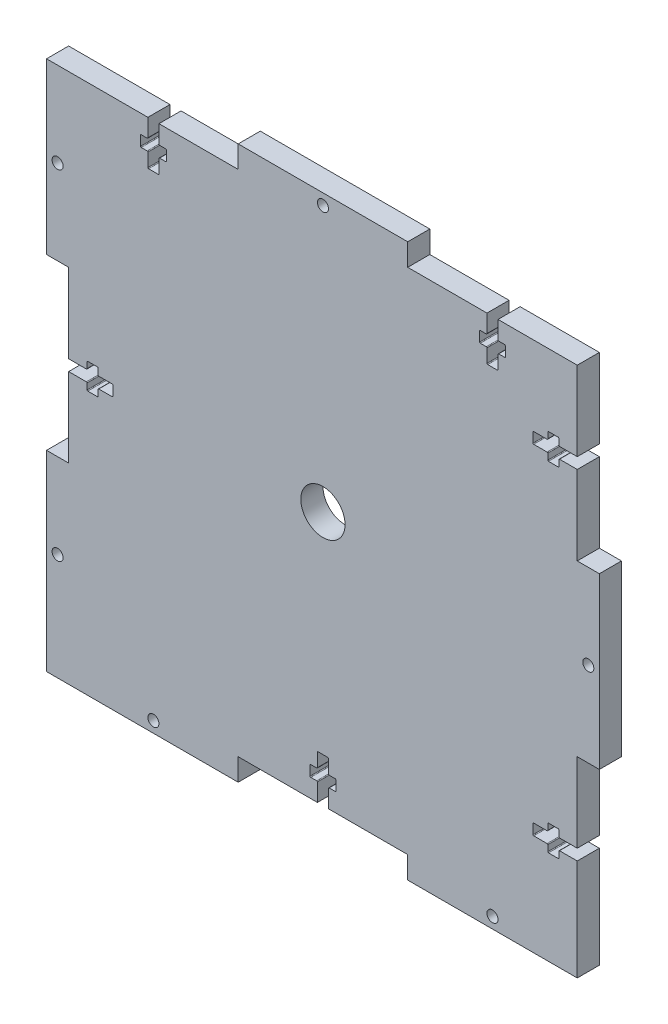
from build123d import *

# Parameters (mm, degrees)
BOX_SIDE_DEPTH       = 6
SKETCH2_R            = 1.5
SCREW_CUT_OUTS_DEPTH = 107.235587258
SKETCH3_R            = 6
BEARINGHOLE_DEPTH    = 107.235587258


with BuildPart() as part:
    # Sketch1 → Box Side (new body)
    with BuildSketch(Plane.XY):
        Polygon((-69, 69), (-23, 69), (-23, 75), (23, 75), (23, 69), (69, 69), (69, 23), (75, 23), (75, -23), (69, -23), (69, -69), (69, -75), (23, -75), (23, -69), (-23, -69), (-23, -75), (-69, -75), (-75, -75), (-75, -69), (-75, -23), (-69, -23), (-69, 23), (-75, 23), (-75, 69), align=None)
    extrude(amount=BOX_SIDE_DEPTH)

    # Sketch2 → Screw Cut-outs (cut, through all)
    with BuildSketch(Plane.XY.offset(6)):
        with Locations((0, 72)):
            Circle(SKETCH2_R)
        with Locations((72, 0)):
            Circle(SKETCH2_R)
        with Locations((-46, -72)):
            Circle(SKETCH2_R)
        with Locations((46, -72)):
            Circle(SKETCH2_R)
        with Locations((-72, 46)):
            Circle(SKETCH2_R)
        with Locations((-72, -46)):
            Circle(SKETCH2_R)
        with BuildLine():
            Line((-44.5, 69), (-44.5, 64.2))
            ThreePointArc((-44.5, 64.2), (-44.441421356, 64.058578644), (-44.3, 64))
            Line((-44.3, 64), (-42.7, 64))
            ThreePointArc((-42.7, 64), (-42.558578644, 63.941421356), (-42.5, 63.8))
            Line((-42.5, 63.8), (-42.5, 61.2))
            ThreePointArc((-42.5, 61.2), (-42.558578644, 61.058578644), (-42.7, 61))
            Line((-42.7, 61), (-44.3, 61))
            ThreePointArc((-44.3, 61), (-44.441421356, 60.941421356), (-44.5, 60.8))
            Line((-44.5, 60.8), (-44.5, 57.2))
            ThreePointArc((-44.5, 57.2), (-44.558578644, 57.058578644), (-44.7, 57))
            Line((-44.7, 57), (-47.3, 57))
            ThreePointArc((-47.3, 57), (-47.441421356, 57.058578644), (-47.5, 57.2))
            Line((-47.5, 57.2), (-47.5, 60.8))
            ThreePointArc((-47.5, 60.8), (-47.558578644, 60.941421356), (-47.7, 61))
            Line((-47.7, 61), (-49.3, 61))
            ThreePointArc((-49.3, 61), (-49.441421356, 61.058578644), (-49.5, 61.2))
            Line((-49.5, 61.2), (-49.5, 63.8))
            ThreePointArc((-49.5, 63.8), (-49.441421356, 63.941421356), (-49.3, 64))
            Line((-49.3, 64), (-47.7, 64))
            ThreePointArc((-47.7, 64), (-47.558578644, 64.058578644), (-47.5, 64.2))
            Line((-47.5, 64.2), (-47.5, 69))
            Line((-47.5, 69), (-44.5, 69))
        make_face()
        with BuildLine():
            Line((47.5, 69), (47.5, 64.2))
            ThreePointArc((47.5, 64.2), (47.558578644, 64.058578644), (47.7, 64))
            Line((47.7, 64), (49.3, 64))
            ThreePointArc((49.3, 64), (49.441421356, 63.941421356), (49.5, 63.8))
            Line((49.5, 63.8), (49.5, 61.2))
            ThreePointArc((49.5, 61.2), (49.441421356, 61.058578644), (49.3, 61))
            Line((49.3, 61), (47.7, 61))
            ThreePointArc((47.7, 61), (47.558578644, 60.941421356), (47.5, 60.8))
            Line((47.5, 60.8), (47.5, 57.2))
            ThreePointArc((47.5, 57.2), (47.441421356, 57.058578644), (47.3, 57))
            Line((47.3, 57), (44.7, 57))
            ThreePointArc((44.7, 57), (44.558578644, 57.058578644), (44.5, 57.2))
            Line((44.5, 57.2), (44.5, 60.8))
            ThreePointArc((44.5, 60.8), (44.441421356, 60.941421356), (44.3, 61))
            Line((44.3, 61), (42.7, 61))
            ThreePointArc((42.7, 61), (42.558578644, 61.058578644), (42.5, 61.2))
            Line((42.5, 61.2), (42.5, 63.8))
            ThreePointArc((42.5, 63.8), (42.558578644, 63.941421356), (42.7, 64))
            Line((42.7, 64), (44.3, 64))
            ThreePointArc((44.3, 64), (44.441421356, 64.058578644), (44.5, 64.2))
            Line((44.5, 64.2), (44.5, 69))
            Line((44.5, 69), (47.5, 69))
        make_face()
        with BuildLine():
            Line((69, 44.5), (64.2, 44.5))
            ThreePointArc((64.2, 44.5), (64.058578644, 44.441421356), (64, 44.3))
            Line((64, 44.3), (64, 42.7))
            ThreePointArc((64, 42.7), (63.941421356, 42.558578644), (63.8, 42.5))
            Line((63.8, 42.5), (61.2, 42.5))
            ThreePointArc((61.2, 42.5), (61.058578644, 42.558578644), (61, 42.7))
            Line((61, 42.7), (61, 44.3))
            ThreePointArc((61, 44.3), (60.941421356, 44.441421356), (60.8, 44.5))
            Line((60.8, 44.5), (57.2, 44.5))
            ThreePointArc((57.2, 44.5), (57.058578644, 44.558578644), (57, 44.7))
            Line((57, 44.7), (57, 47.3))
            ThreePointArc((57, 47.3), (57.058578644, 47.441421356), (57.2, 47.5))
            Line((57.2, 47.5), (60.8, 47.5))
            ThreePointArc((60.8, 47.5), (60.941421356, 47.558578644), (61, 47.7))
            Line((61, 47.7), (61, 49.3))
            ThreePointArc((61, 49.3), (61.058578644, 49.441421356), (61.2, 49.5))
            Line((61.2, 49.5), (63.8, 49.5))
            ThreePointArc((63.8, 49.5), (63.941421356, 49.441421356), (64, 49.3))
            Line((64, 49.3), (64, 47.7))
            ThreePointArc((64, 47.7), (64.058578644, 47.558578644), (64.2, 47.5))
            Line((64.2, 47.5), (69, 47.5))
            Line((69, 47.5), (69, 44.5))
        make_face()
        with BuildLine():
            Line((69, -47.5), (64.2, -47.5))
            ThreePointArc((64.2, -47.5), (64.058578644, -47.558578644), (64, -47.7))
            Line((64, -47.7), (64, -49.3))
            ThreePointArc((64, -49.3), (63.941421356, -49.441421356), (63.8, -49.5))
            Line((63.8, -49.5), (61.2, -49.5))
            ThreePointArc((61.2, -49.5), (61.058578644, -49.441421356), (61, -49.3))
            Line((61, -49.3), (61, -47.7))
            ThreePointArc((61, -47.7), (60.941421356, -47.558578644), (60.8, -47.5))
            Line((60.8, -47.5), (57.2, -47.5))
            ThreePointArc((57.2, -47.5), (57.058578644, -47.441421356), (57, -47.3))
            Line((57, -47.3), (57, -44.7))
            ThreePointArc((57, -44.7), (57.058578644, -44.558578644), (57.2, -44.5))
            Line((57.2, -44.5), (60.8, -44.5))
            ThreePointArc((60.8, -44.5), (60.941421356, -44.441421356), (61, -44.3))
            Line((61, -44.3), (61, -42.7))
            ThreePointArc((61, -42.7), (61.058578644, -42.558578644), (61.2, -42.5))
            Line((61.2, -42.5), (63.8, -42.5))
            ThreePointArc((63.8, -42.5), (63.941421356, -42.558578644), (64, -42.7))
            Line((64, -42.7), (64, -44.3))
            ThreePointArc((64, -44.3), (64.058578644, -44.441421356), (64.2, -44.5))
            Line((64.2, -44.5), (69, -44.5))
            Line((69, -44.5), (69, -47.5))
        make_face()
        with BuildLine():
            Line((-1.5, -69), (1.5, -69))
            Line((1.5, -69), (1.5, -64.2))
            ThreePointArc((1.5, -64.2), (1.558578644, -64.058578644), (1.7, -64))
            Line((1.7, -64), (3.3, -64))
            ThreePointArc((3.3, -64), (3.441421356, -63.941421356), (3.5, -63.8))
            Line((3.5, -63.8), (3.5, -61.2))
            ThreePointArc((3.5, -61.2), (3.441421356, -61.058578644), (3.3, -61))
            Line((3.3, -61), (1.7, -61))
            ThreePointArc((1.7, -61), (1.558578644, -60.941421356), (1.5, -60.8))
            Line((1.5, -60.8), (1.5, -57.2))
            ThreePointArc((1.5, -57.2), (1.441421356, -57.058578644), (1.3, -57))
            Line((1.3, -57), (-1.3, -57))
            ThreePointArc((-1.3, -57), (-1.441421356, -57.058578644), (-1.5, -57.2))
            Line((-1.5, -57.2), (-1.5, -60.8))
            ThreePointArc((-1.5, -60.8), (-1.558578644, -60.941421356), (-1.7, -61))
            Line((-1.7, -61), (-3.3, -61))
            ThreePointArc((-3.3, -61), (-3.441421356, -61.058578644), (-3.5, -61.2))
            Line((-3.5, -61.2), (-3.5, -63.8))
            ThreePointArc((-3.5, -63.8), (-3.441421356, -63.941421356), (-3.3, -64))
            Line((-3.3, -64), (-1.7, -64))
            ThreePointArc((-1.7, -64), (-1.558578644, -64.058578644), (-1.5, -64.2))
            Line((-1.5, -64.2), (-1.5, -69))
        make_face()
        with BuildLine():
            Line((-69, -1.5), (-64.2, -1.5))
            ThreePointArc((-64.2, -1.5), (-64.058578644, -1.558578644), (-64, -1.7))
            Line((-64, -1.7), (-64, -3.3))
            ThreePointArc((-64, -3.3), (-63.941421356, -3.441421356), (-63.8, -3.5))
            Line((-63.8, -3.5), (-61.2, -3.5))
            ThreePointArc((-61.2, -3.5), (-61.058578644, -3.441421356), (-61, -3.3))
            Line((-61, -3.3), (-61, -1.7))
            ThreePointArc((-61, -1.7), (-60.941421356, -1.558578644), (-60.8, -1.5))
            Line((-60.8, -1.5), (-57.2, -1.5))
            ThreePointArc((-57.2, -1.5), (-57.058578644, -1.441421356), (-57, -1.3))
            Line((-57, -1.3), (-57, 1.3))
            ThreePointArc((-57, 1.3), (-57.058578644, 1.441421356), (-57.2, 1.5))
            Line((-57.2, 1.5), (-60.8, 1.5))
            ThreePointArc((-60.8, 1.5), (-60.941421356, 1.558578644), (-61, 1.7))
            Line((-61, 1.7), (-61, 3.3))
            ThreePointArc((-61, 3.3), (-61.058578644, 3.441421356), (-61.2, 3.5))
            Line((-61.2, 3.5), (-63.8, 3.5))
            ThreePointArc((-63.8, 3.5), (-63.941421356, 3.441421356), (-64, 3.3))
            Line((-64, 3.3), (-64, 1.7))
            ThreePointArc((-64, 1.7), (-64.058578644, 1.558578644), (-64.2, 1.5))
            Line((-64.2, 1.5), (-69, 1.5))
            Line((-69, 1.5), (-69, -1.5))
        make_face()
    extrude(amount=-SCREW_CUT_OUTS_DEPTH, mode=Mode.SUBTRACT)

    # Sketch3 → BearingHole (cut, through all)
    with BuildSketch(Plane.XY.offset(6)):
        Circle(SKETCH3_R)
    extrude(amount=-BEARINGHOLE_DEPTH, mode=Mode.SUBTRACT)


solid = part.part
